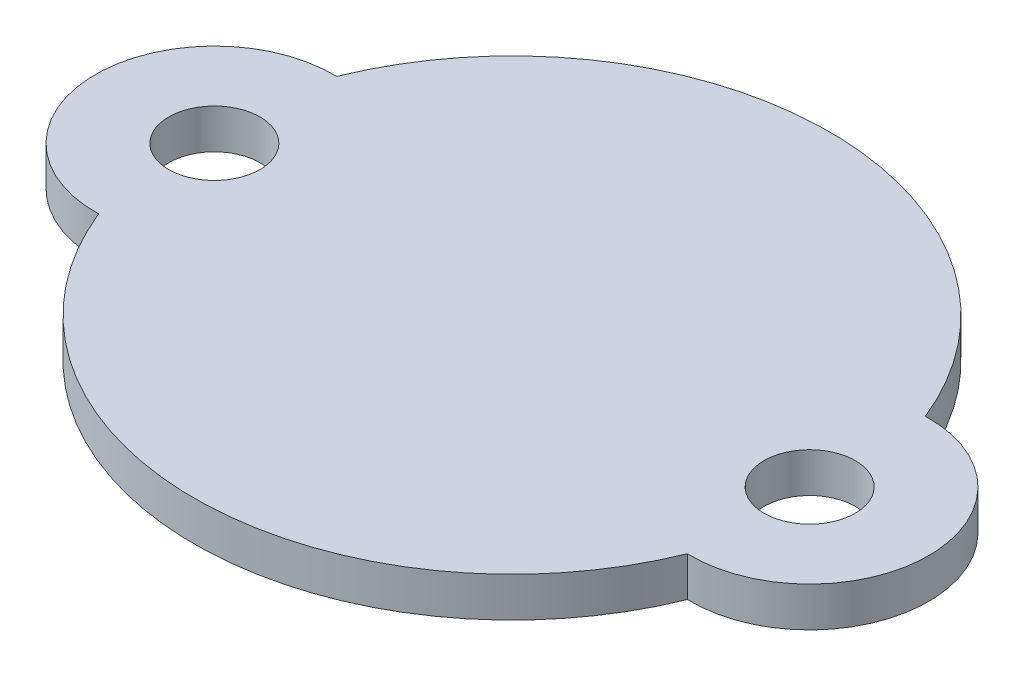
from build123d import *

# Parameters (mm, degrees)
SKETCH1_R           = 1.15
BOSS_EXTRUDE1_DEPTH = 1


with BuildPart() as part:
    # Sketch1 → Boss-Extrude1 (new body)
    with BuildSketch(Plane(origin=(0, 0, 0), x_dir=(1, 0, 0), z_dir=(0, 1, 0))):
        with BuildLine():
            ThreePointArc((7.416666667, 2.998842369), (0, 8), (-7.416666667, 2.998842369))
            ThreePointArc((-7.416666667, 2.998842369), (-10.5, 0), (-7.416666667, -2.998842369))
            ThreePointArc((-7.416666667, -2.998842369), (0, -8), (7.416666667, -2.998842369))
            ThreePointArc((7.416666667, -2.998842369), (10.5, 0), (7.416666667, 2.998842369))
        make_face()
        with Locations((7.5, 0)):
            Circle(SKETCH1_R, mode=Mode.SUBTRACT)
        with Locations((-7.5, 0)):
            Circle(SKETCH1_R, mode=Mode.SUBTRACT)
    extrude(amount=BOSS_EXTRUDE1_DEPTH)


solid = part.part
